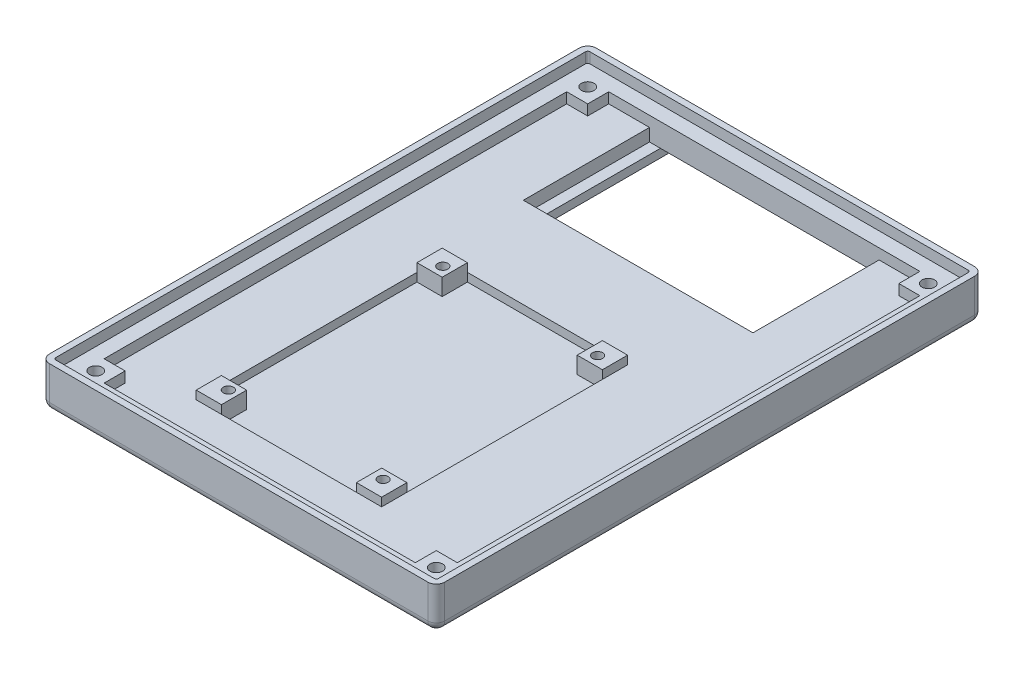
from build123d import *

# Parameters (mm, degrees)
SKETCH1_W           = 94
SKETCH1_H           = 130
BOSS_EXTRUDE1_DEPTH = 5
SKETCH2_W           = 94
SKETCH2_H           = 130
SKETCH2_W_2         = 84
SKETCH2_H_2         = 120
BOSS_EXTRUDE2_DEPTH = 5
FILLET1_R           = 2
SKETCH3_W           = 44.1
SKETCH3_H           = 58.5
CUT_EXTRUDE1_DEPTH  = 2
SKETCH5_W           = 6
SKETCH5_H           = 6
BOSS_EXTRUDE4_DEPTH = 4
SKETCH7_R           = 1.20000014
CUT_EXTRUDE2_DEPTH  = 3
SKETCH8_W           = 54.6
SKETCH8_H           = 30
CUT_EXTRUDE3_DEPTH  = 3
SKETCH9_W           = 49.4
SKETCH9_H           = 27
CUT_EXTRUDE4_DEPTH  = 2
SKETCH10_W          = 49.4
SKETCH10_H          = 6.619549161
CUT_EXTRUDE5_DEPTH  = 2
SKETCH11_W          = 5
SKETCH11_H          = 1
CUT_EXTRUDE6_DEPTH  = 3
SKETCH14_W          = 84
SKETCH14_H          = 120
CUT_EXTRUDE8_DEPTH  = 2.5
SKETCH15_W          = 5
SKETCH15_H          = 5
BOSS_EXTRUDE5_DEPTH = 2.5
SKETCH16_R          = 1.5
CUT_EXTRUDE9_DEPTH  = 161.599657534
SKETCH17_R          = 2.8
CUT_EXTRUDE10_DEPTH = 3
SKETCH18_R          = 4
CUT_EXTRUDE11_DEPTH = 2


with BuildPart() as part:
    # Sketch1 → Boss-Extrude1 (new body)
    with BuildSketch(Plane(origin=(0, 0, 0), x_dir=(1, 0, 0), z_dir=(0, 1, 0))):
        with Locations((47, 65)):
            Rectangle(SKETCH1_W, SKETCH1_H)
    extrude(amount=BOSS_EXTRUDE1_DEPTH)

    # Sketch2 → Boss-Extrude2 (add)
    with BuildSketch(Plane(origin=(0, 5, 0), x_dir=(1, 0, 0), z_dir=(0, 1, 0))):
        with Locations((47, 65)):
            Rectangle(SKETCH2_W, SKETCH2_H)
        with Locations((47, 65)):
            Rectangle(SKETCH2_W_2, SKETCH2_H_2, mode=Mode.SUBTRACT)
    extrude(amount=BOSS_EXTRUDE2_DEPTH)

    # Fillet1
    fillet1_edges = [part.edges().sort_by_distance(p)[0] for p in [
        (0, 5, -130),
        (0, 5, 0),
        (94, 5, 0),
        (47, 0, 0),
        (0, 0, -65),
        (94, 0, -65),
        (47, 0, -130),
        (94, 5, -130),
    ]]
    fillet(fillet1_edges, radius=FILLET1_R)

    # Sketch3 → Cut-Extrude1 (cut)
    with BuildSketch(Plane(origin=(0, 5, 0), x_dir=(1, 0, 0), z_dir=(0, 1, 0))):
        with Locations((43.95, 44.25)):
            Rectangle(SKETCH3_W, SKETCH3_H)
    extrude(amount=-CUT_EXTRUDE1_DEPTH, mode=Mode.SUBTRACT)

    # Sketch5 → Boss-Extrude4 (add)
    with BuildSketch(Plane(origin=(0, 3, 0), x_dir=(1, 0, 0), z_dir=(0, 1, 0))):
        with Locations((24.9, 70.5)):
            Rectangle(SKETCH5_W, SKETCH5_H)
        with Locations((63, 70.5)):
            Rectangle(SKETCH5_W, SKETCH5_H)
        with Locations((63, 18)):
            Rectangle(SKETCH5_W, SKETCH5_H)
        with Locations((24.9, 18)):
            Rectangle(SKETCH5_W, SKETCH5_H)
    extrude(amount=BOSS_EXTRUDE4_DEPTH)

    # Sketch7 → Cut-Extrude2 (cut)
    with BuildSketch(Plane(origin=(0, 7, 0), x_dir=(1, 0, 0), z_dir=(0, 1, 0))):
        with Locations((25.710000549, 69.839000092)):
            Circle(SKETCH7_R)
        with Locations((62.514600549, 69.839000092)):
            Circle(SKETCH7_R)
        with Locations((62.514600549, 18.835800092)):
            Circle(SKETCH7_R)
        with Locations((25.710000549, 18.835800092)):
            Circle(SKETCH7_R)
    extrude(amount=-CUT_EXTRUDE2_DEPTH, mode=Mode.SUBTRACT)

    # Sketch8 → Cut-Extrude3 (cut)
    with BuildSketch(Plane(origin=(0, 5, 0), x_dir=(1, 0, 0), z_dir=(0, 1, 0))):
        with Locations((47, 110)):
            Rectangle(SKETCH8_W, SKETCH8_H)
    extrude(amount=-CUT_EXTRUDE3_DEPTH, mode=Mode.SUBTRACT)

    # Sketch9 → Cut-Extrude4 (cut)
    with BuildSketch(Plane(origin=(0, 2, 0), x_dir=(1, 0, 0), z_dir=(0, 1, 0))):
        with Locations((47, 110)):
            Rectangle(SKETCH9_W, SKETCH9_H)
    extrude(amount=-CUT_EXTRUDE4_DEPTH, mode=Mode.SUBTRACT)

    # Sketch10 → Cut-Extrude5 (cut)
    with BuildSketch(Plane.XZ):
        with Locations((47, -126.809774581)):
            Rectangle(SKETCH10_W, SKETCH10_H)
    extrude(amount=-CUT_EXTRUDE5_DEPTH, mode=Mode.SUBTRACT)

    # Sketch11 → Cut-Extrude6 (cut)
    with BuildSketch(Plane(origin=(0, 0, -96.5), x_dir=(-1, 0, 0), z_dir=(0, 0, -1))):
        with Locations((-47, 1)):
            Rectangle(SKETCH11_W, SKETCH11_H)
    extrude(amount=-CUT_EXTRUDE6_DEPTH, mode=Mode.SUBTRACT)

    # Sketch14 → Cut-Extrude8 (cut)
    with BuildSketch(Plane(origin=(0, 10, 0), x_dir=(1, 0, 0), z_dir=(0, 1, 0))):
        with BuildLine():
            Line((92.5, 2), (92.5, 128))
            ThreePointArc((92.5, 128), (92.353553391, 128.353553391), (92, 128.5))
            Line((92, 128.5), (2, 128.5))
            ThreePointArc((2, 128.5), (1.646446609, 128.353553391), (1.5, 128))
            Line((1.5, 128), (1.5, 2))
            ThreePointArc((1.5, 2), (1.646446609, 1.646446609), (2, 1.5))
            Line((2, 1.5), (92, 1.5))
            ThreePointArc((92, 1.5), (92.353553391, 1.646446609), (92.5, 2))
        make_face()
        with Locations((47, 65)):
            Rectangle(SKETCH14_W, SKETCH14_H, mode=Mode.SUBTRACT)
    extrude(amount=-CUT_EXTRUDE8_DEPTH, mode=Mode.SUBTRACT)

    # Sketch15 → Boss-Extrude5 (add)
    with BuildSketch(Plane(origin=(0, 5, 0), x_dir=(1, 0, 0), z_dir=(0, 1, 0))):
        with Locations((86.5, 122.5)):
            Rectangle(SKETCH15_W, SKETCH15_H)
        with Locations((7.5, 122.5)):
            Rectangle(SKETCH15_W, SKETCH15_H)
        with Locations((7.5, 7.5)):
            Rectangle(SKETCH15_W, SKETCH15_H)
        with Locations((86.5, 7.5)):
            Rectangle(SKETCH15_W, SKETCH15_H)
    extrude(amount=BOSS_EXTRUDE5_DEPTH)

    # Sketch16 → Cut-Extrude9 (cut, through all)
    with BuildSketch(Plane(origin=(0, 7.5, 0), x_dir=(1, 0, 0), z_dir=(0, 1, 0))):
        with Locations((6.5, 123.5)):
            Circle(SKETCH16_R)
        with Locations((87.5, 123.5)):
            Circle(SKETCH16_R)
        with Locations((87.5, 6.5)):
            Circle(SKETCH16_R)
        with Locations((6.5, 6.5)):
            Circle(SKETCH16_R)
    extrude(amount=-CUT_EXTRUDE9_DEPTH, mode=Mode.SUBTRACT)

    # Sketch17 → Cut-Extrude10 (cut)
    with BuildSketch(Plane.XZ):
        with Locations((6.5, -6.5)):
            Circle(SKETCH17_R)
        with Locations((87.5, -6.5)):
            Circle(SKETCH17_R)
        with Locations((87.5, -123.5)):
            Circle(SKETCH17_R)
        with Locations((6.5, -123.5)):
            Circle(SKETCH17_R)
    extrude(amount=-CUT_EXTRUDE10_DEPTH, mode=Mode.SUBTRACT)

    # Sketch18 → Cut-Extrude11 (cut)
    with BuildSketch(Plane.XZ):
        with Locations((6.5, -123.5)):
            Circle(SKETCH18_R)
        with Locations((87.5, -123.5)):
            Circle(SKETCH18_R)
        with Locations((87.5, -6.5)):
            Circle(SKETCH18_R)
        with Locations((6.5, -6.5)):
            Circle(SKETCH18_R)
    extrude(amount=-CUT_EXTRUDE11_DEPTH, mode=Mode.SUBTRACT)


solid = part.part
